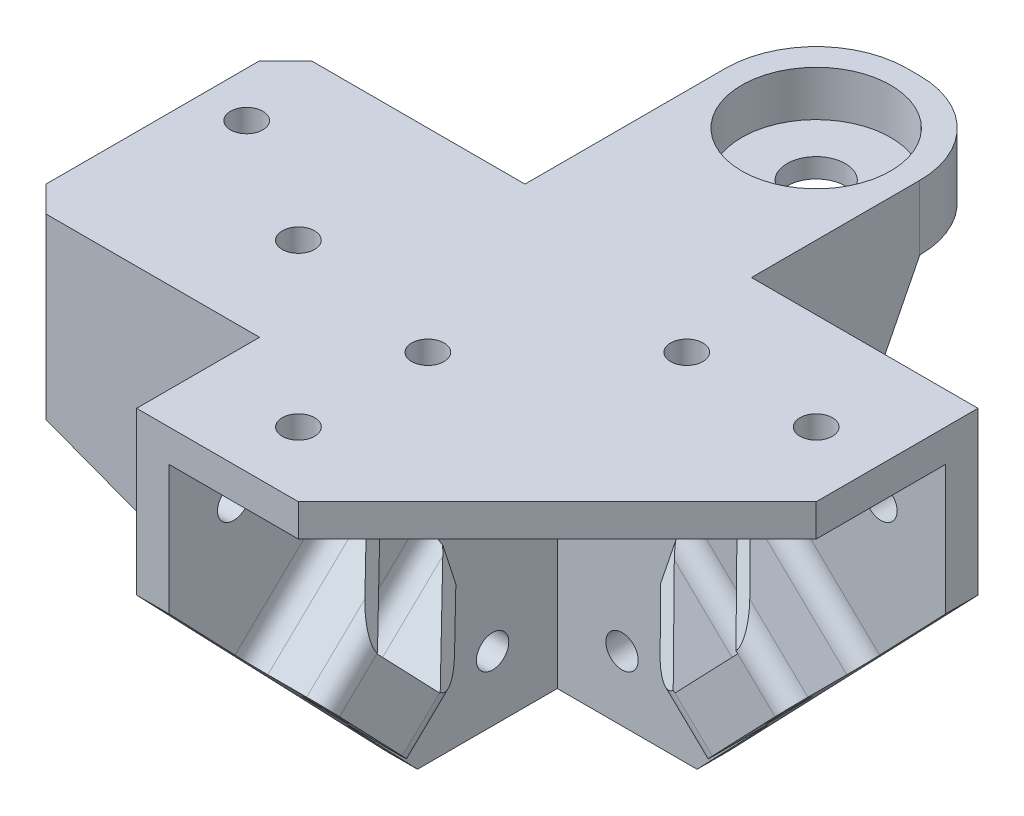
from build123d import *

# Parameters (mm, degrees)
SKETCH1_R           = 2.5
BOSS_EXTRUDE1_DEPTH = 5
BOSS_EXTRUDE3_DEPTH = 5
BOSS_EXTRUDE4_DEPTH = 5
SKETCH5_R           = 2.5
CUT_EXTRUDE1_DEPTH  = 102.612007165
SKETCH6_R           = 2.5
CUT_EXTRUDE2_DEPTH  = 103.610915599
SKETCH7_W           = 30
SKETCH7_H           = 10
BOSS_EXTRUDE5_DEPTH = 40
SKETCH8_R           = 11.5
CUT_EXTRUDE3_DEPTH  = 7
SKETCH9_R           = 4.5
CUT_EXTRUDE4_DEPTH  = 100.76973489
FILLET1_R           = 14
RIB2_REACH          = 106.163
SKETCH10_WALL_W     = 271.162511258
SKETCH10_WALL_H     = 3
RIB11_REACH         = 107.423
SKETCH12_WALL_W     = 270.500688682
SKETCH12_WALL_H     = 3
BOSS_EXTRUDE6_DEPTH = 12
SKETCH15_R          = 3
CUT_EXTRUDE5_DEPTH  = 10
CUT_EXTRUDE6_DEPTH  = 4
BOSS_EXTRUDE7_DEPTH = 12
SKETCH19_R          = 3
CUT_EXTRUDE8_DEPTH  = 36
CUT_EXTRUDE9_DEPTH  = 4
CUT_EXTRUDE10_DEPTH = 23
CUT_EXTRUDE16_DEPTH = 21
FILLET2_R           = 3
SKETCH22_R          = 2.5
CUT_EXTRUDE12_DEPTH = 10
SKETCH30_W          = 35
SKETCH30_H          = 3
BOSS_EXTRUDE8_DEPTH = 37
RIB13_START         = -3
RIB13_DEPTH         = 3
RIB14_START         = -3
RIB14_DEPTH         = 3
CHAMFER1_SIZE       = 4
CUT_EXTRUDE13_REACH = 101.77
SKETCH26_W          = 20
SKETCH26_H          = 20
CUT_EXTRUDE14_REACH = 132.495
SKETCH27_W          = 20
SKETCH27_H          = 20
SKETCH28_W          = 20
SKETCH28_H          = 20
CUT_EXTRUDE15_DEPTH = 60
SKETCH31_R          = 2.5
CUT_EXTRUDE17_DEPTH = 37
CHAMFER2_SIZE       = 3


# Read off the part's stored shape, not the designer's step: Rib13, Rib14
with BuildPart() as part:
    # Sketch1 → Boss-Extrude1 (new body)
    with BuildSketch(Plane(origin=(0, 0, 0), x_dir=(1, 0, 0), z_dir=(0, 1, 0))):
        Polygon((50, -10), (10, -50), (-10, -50), (-10, -31), (-52, -31), (-52, 10), (-10, 10), (-10, 15), (50, 15), align=None)
        with Locations(Location((20, 0, 0), (0, 0, 270))):
            Circle(SKETCH1_R, mode=Mode.SUBTRACT)
        with Locations(Location((40, 0, 0), (0, 0, 270))):
            Circle(SKETCH1_R, mode=Mode.SUBTRACT)
        with Locations(Location((0, -20, 0), (0, 0, 270))):
            Circle(SKETCH1_R, mode=Mode.SUBTRACT)
        with Locations(Location((0, -40, 0), (0, 0, 270))):
            Circle(SKETCH1_R, mode=Mode.SUBTRACT)
    extrude(amount=BOSS_EXTRUDE1_DEPTH)

    # Sketch3 → Boss-Extrude3 (add)
    with BuildSketch(Plane(origin=(0, 0, -15), x_dir=(-1, 0, 0), z_dir=(0, 0, -1))):
        Polygon((-50, 5), (-50, -20), (-11.601154601, -60), (10, -60), (10, 5), align=None)
    extrude(amount=-BOSS_EXTRUDE3_DEPTH)

    # Sketch4 → Boss-Extrude4 (add)
    with BuildSketch(Plane(origin=(-10, 0, 0), x_dir=(0, 0, -1), z_dir=(1, 0, 0))):
        Polygon((15, 5), (-50, 5), (-50, -20), (-11.601154601, -60), (15, -60), align=None)
    extrude(amount=-BOSS_EXTRUDE4_DEPTH)

    # Sketch5 → Cut-Extrude1 (cut, through all)
    with BuildSketch(Plane.ZY.offset(15)):
        with Locations((0, -10)):
            Circle(SKETCH5_R)
        with Locations((0, -30)):
            Circle(SKETCH5_R)
        with Locations((0, -50)):
            Circle(SKETCH5_R)
        with Locations((20, -10)):
            Circle(SKETCH5_R)
        with Locations((40, -10)):
            Circle(SKETCH5_R)
    extrude(amount=-CUT_EXTRUDE1_DEPTH, mode=Mode.SUBTRACT)

    # Sketch6 → Cut-Extrude2 (cut, through all)
    with BuildSketch(Plane(origin=(0, 0, -15), x_dir=(-1, 0, 0), z_dir=(0, 0, -1))):
        with Locations((0, -10)):
            Circle(SKETCH6_R)
        with Locations((0, -30)):
            Circle(SKETCH6_R)
        with Locations((0, -50)):
            Circle(SKETCH6_R)
        with Locations((-20, -10)):
            Circle(SKETCH6_R)
        with Locations((-40, -10)):
            Circle(SKETCH6_R)
    extrude(amount=-CUT_EXTRUDE2_DEPTH, mode=Mode.SUBTRACT)

    # Sketch7 → Boss-Extrude5 (add)
    with BuildSketch(Plane(origin=(0, 0, -15), x_dir=(-1, 0, 0), z_dir=(0, 0, -1))):
        Rectangle(SKETCH7_W, SKETCH7_H)
    extrude(amount=BOSS_EXTRUDE5_DEPTH)

    # Sketch8 → Cut-Extrude3 (cut)
    with BuildSketch(Plane(origin=(0, 5, 0), x_dir=(1, 0, 0), z_dir=(0, 1, 0))):
        with Locations(Location((0, 40, 0), (0, 0, 270))):
            Circle(SKETCH8_R)
    extrude(amount=-CUT_EXTRUDE3_DEPTH, mode=Mode.SUBTRACT)

    # Sketch9 → Cut-Extrude4 (cut, through all)
    with BuildSketch(Plane(origin=(0, 5, 0), x_dir=(1, 0, 0), z_dir=(0, 1, 0))):
        with Locations(Location((0, 40, 0), (0, 0, 270))):
            Circle(SKETCH9_R)
    extrude(amount=-CUT_EXTRUDE4_DEPTH, mode=Mode.SUBTRACT)

    # Fillet1
    fillet1_edges = [part.edges().sort_by_distance(p)[0] for p in [
        (-15, 0, -55),
        (15, 0, -55),
    ]]
    fillet(fillet1_edges, radius=FILLET1_R)

    # Sketch10 wall → Rib2 (add, up to next)
    with BuildSketch(Plane(origin=(-15, -32.5, -28), x_dir=(0, -0.904072266505, 0.427379616893), z_dir=(0, 0.427379616893, 0.904072266505)), mode=Mode.PRIVATE) as rib2_sk1:
        with Locations((0, 1.5)):
            Rectangle(SKETCH10_WALL_W, SKETCH10_WALL_H)
    rib2_tool1 = extrude(rib2_sk1.sketch, amount=RIB2_REACH, mode=Mode.PRIVATE) - part.part
    add(rib2_tool1.solids().sort_by_distance((-15, -32.5, -28))[0])

    # Sketch12 wall → Rib11 (add, up to next)
    with BuildSketch(Plane(origin=(15, -30.729714793, -28), x_dir=(0, -0.892544130701, 0.450960058931), z_dir=(0, -0.450960058931, -0.892544130701)), mode=Mode.PRIVATE) as rib11_sk1:
        with Locations((0, 1.5)):
            Rectangle(SKETCH12_WALL_W, SKETCH12_WALL_H)
    rib11_tool1 = extrude(rib11_sk1.sketch, amount=-RIB11_REACH, mode=Mode.PRIVATE) - part.part
    add(rib11_tool1.solids().sort_by_distance((15, -30.729714793, -28))[0])

    # Sketch13 → Boss-Extrude6 (add)
    with BuildSketch(Plane(origin=(-10, 0, 0), x_dir=(0, 0, -1), z_dir=(1, 0, 0))):
        Polygon((-23.875367383, -47.213977239), (-37.725787218, -32.786022761), (-19.335645208, -15.132017263), (-17.258082232, -17.296210435), (-29.877042452, -29.410047999), (-20.181748567, -39.509616133), (-7.127255585, -26.977679689), (-5.04969261, -29.14187286), align=None)
    extrude(amount=BOSS_EXTRUDE6_DEPTH)

    # Sketch15 → Cut-Extrude5 (cut)
    with BuildSketch(Plane(origin=(0, -34.570859839, 36.012395143), x_dir=(1, 0, 0), z_dir=(0, -0.6925209917473573, 0.7213977238592154))):
        with Locations(Location((-5, -7.525862616, 0), (0, 0, 270))):
            Circle(SKETCH15_R)
    extrude(amount=-CUT_EXTRUDE5_DEPTH, mode=Mode.SUBTRACT)

    # Sketch16 → Cut-Extrude6 (cut)
    with BuildSketch(Plane(origin=(0, -29.030691905, 30.241213352), x_dir=(1, 0, 0), z_dir=(0, 0.692520991747357, -0.7213977238592156))):
        Polygon((0, 4.63911127), (0, 10.412613962), (-5, 13.299365308), (-10, 10.412613962), (-10, 4.63911127), (-5, 1.752359924), align=None)
    extrude(amount=-CUT_EXTRUDE6_DEPTH, mode=Mode.SUBTRACT)

    # Sketch18 → Boss-Extrude7 (add)
    with BuildSketch(Plane.XY.offset(-10)):
        Polygon((37.725787218, -32.786022761), (23.875367383, -47.213977239), (6.052764198, -30.104792631), (8.130327173, -27.940599459), (20.181748567, -39.509616133), (29.877042452, -29.410047999), (17.825621058, -17.841031325), (19.903184033, -15.676838154), align=None)
    extrude(amount=BOSS_EXTRUDE7_DEPTH)

    # Sketch19 → Cut-Extrude8 (cut)
    with BuildSketch(Plane(origin=(36.012395143, -34.570859839, 0), x_dir=(0, 0, -1), z_dir=(0.7213977238592155, -0.6925209917473573, 0))):
        with Locations(Location((5, -7.525862616, 0), (0, 0, 90))):
            Circle(SKETCH19_R)
    extrude(amount=-CUT_EXTRUDE8_DEPTH, mode=Mode.SUBTRACT)

    # Sketch20 → Cut-Extrude9 (cut)
    with BuildSketch(Plane(origin=(30.241213352, -29.030691905, 0), x_dir=(0, 0, 1), z_dir=(-0.7213977238592155, 0.6925209917473573, 0))):
        Polygon((0, -4.63911127), (-5, -1.752359924), (-10, -4.63911127), (-10, -10.412613962), (-5, -13.299365308), (0, -10.412613962), align=None)
    extrude(amount=-CUT_EXTRUDE9_DEPTH, mode=Mode.SUBTRACT)

    # Sketch21 → Cut-Extrude10 (cut)
    with BuildSketch(Plane(origin=(-12.13702776, -12.6431174, 0), x_dir=(0, 0, 1), z_dir=(-0.692520991747357, -0.7213977238592157, 0))):
        Polygon((-10, -25.214651165), (2, -41.537413908), (2, -25.214651165), align=None)
    extrude(amount=-CUT_EXTRUDE10_DEPTH, mode=Mode.SUBTRACT)

    # Sketch29 → Cut-Extrude16 (cut)
    with BuildSketch(Plane(origin=(0, 1.784837077, 1.713392075), x_dir=(1, 0, 0), z_dir=(0, 0.7213977238592151, 0.6925209917473576))):
        Polygon((-10, -24.427930044), (2, -24.427930044), (2, -41.795508388), align=None)
    extrude(amount=-CUT_EXTRUDE16_DEPTH, mode=Mode.SUBTRACT)

    # Fillet2
    # the kernel refuses this fillet: 3 mm, written as the material it adds along each edge
    with BuildSketch(Plane(origin=(35.287525381, -34.603955437, -10), x_dir=(-0.6925209917473568, -0.7213977238592159, 0), z_dir=(-0.7213977238592159, 0.6925209917473568, 0))) as fillet2_piece_1_section:
        with BuildLine():
            CenterArc((FILLET2_R, FILLET2_R), FILLET2_R, 180, 90)
            Line((0, FILLET2_R), (0, 0))
            Line((0, 0), (FILLET2_R, 0))
        make_face()
    fillet2_piece_1 = extrude(amount=31.705654863, mode=Mode.PRIVATE)
    fillet2_piece_1 = split(fillet2_piece_1, bisect_by=Plane(origin=(27.168396229, -27.751311097, 0.000464063), z_dir=(0.4273021697203565, -0.41019774884719234, -0.8056988659499105)), keep=Keep.TOP, mode=Mode.PRIVATE)
    add(fillet2_piece_1)
    with BuildSketch(Plane(origin=(2.719844244, -22.746692021, -10), x_dir=(0.6925209917473568, 0.7213977238592157, 0), z_dir=(0.7213977238592157, -0.6925209917473569, 0))) as fillet2_piece_2_section:
        with BuildLine():
            CenterArc((FILLET2_R, FILLET2_R), FILLET2_R, 180, 90)
            Line((0, FILLET2_R), (0, 0))
            Line((0, 0), (FILLET2_R, 0))
        make_face()
    fillet2_piece_2 = extrude(amount=31.705654863, mode=Mode.PRIVATE)
    fillet2_piece_2 = split(fillet2_piece_2, bisect_by=Plane(origin=(12.953271486, -31.599477719, -5.57934317), z_dir=(0.4273021697203565, -0.41019774884719234, -0.8056988659499105)), keep=Keep.TOP, mode=Mode.PRIVATE)
    add(fillet2_piece_2)
    with BuildSketch(Plane(origin=(-10, -32.786022761, 37.725787218), x_dir=(0, 0.721397723859215, 0.6925209917473576), z_dir=(0, 0.6925209917473576, -0.7213977238592151))) as fillet2_piece_3_section:
        with BuildLine():
            CenterArc((FILLET2_R, FILLET2_R), FILLET2_R, 180, 90)
            Line((0, FILLET2_R), (0, 0))
            Line((0, 0), (FILLET2_R, 0))
        make_face()
    fillet2_piece_3 = extrude(amount=32.992375983, mode=Mode.PRIVATE)
    fillet2_piece_3 = split(fillet2_piece_3, bisect_by=Plane(origin=(-3.605950739, -21.040183536, 26.491984379), z_dir=(-0.822717439175792, -0.3936639310194599, 0.41007892495266446)), keep=Keep.TOP, mode=Mode.PRIVATE)
    add(fillet2_piece_3)
    with BuildSketch(Plane(origin=(-10, -12.102302997, 11.847599303), x_dir=(0, -0.7213977238592152, -0.6925209917473575), z_dir=(0, -0.6925209917473575, 0.7213977238592153))) as fillet2_piece_4_section:
        with BuildLine():
            CenterArc((FILLET2_R, FILLET2_R), FILLET2_R, 180, 90)
            Line((0, FILLET2_R), (0, 0))
            Line((0, 0), (FILLET2_R, 0))
        make_face()
    fillet2_piece_4 = extrude(amount=32.492375983, mode=Mode.PRIVATE)
    fillet2_piece_4 = split(fillet2_piece_4, bisect_by=Plane(origin=(-5.484565801, -22.327549984, 21.487193874), z_dir=(-0.822717439175792, -0.3936639310194599, 0.41007892495266446)), keep=Keep.TOP, mode=Mode.PRIVATE)
    add(fillet2_piece_4)
    with BuildSketch(Plane(origin=(-10, -44.703523571, 25.592231496), x_dir=(0, 0.7213977238592155, 0.6925209917473572), z_dir=(0, 0.6925209917473573, -0.7213977238592155))) as fillet2_piece_5_section:
        with BuildLine():
            CenterArc((FILLET2_R, FILLET2_R), FILLET2_R, 180, 90)
            Line((0, FILLET2_R), (0, 0))
            Line((0, 0), (FILLET2_R, 0))
        make_face()
    fillet2_piece_5 = extrude(amount=24.992375983, mode=Mode.PRIVATE)
    fillet2_piece_5 = split(fillet2_piece_5, bisect_by=Plane(origin=(0.153979839, -37.082991212, 18.634681598), z_dir=(-0.822717439175792, -0.3936639310194599, 0.41007892495266446)), keep=Keep.TOP, mode=Mode.PRIVATE)
    add(fillet2_piece_5)
    with BuildSketch(Plane(origin=(-10, -29.559971741, 5.485225373), x_dir=(0, -0.7213977238592156, -0.692520991747357), z_dir=(0, -0.692520991747357, 0.7213977238592156))) as fillet2_piece_6_section:
        with BuildLine():
            CenterArc((FILLET2_R, FILLET2_R), FILLET2_R, 180, 90)
            Line((0, FILLET2_R), (0, 0))
            Line((0, 0), (FILLET2_R, 0))
        make_face()
    fillet2_piece_6 = extrude(amount=25.492375983, mode=Mode.PRIVATE)
    fillet2_piece_6 = split(fillet2_piece_6, bisect_by=Plane(origin=(-3.60504069, -36.469949644, 11.681680074), z_dir=(-0.822717439175792, -0.3936639310194599, 0.41007892495266446)), keep=Keep.TOP, mode=Mode.PRIVATE)
    add(fillet2_piece_6)
    with BuildSketch(Plane(origin=(14.492701104, -10.482930716, -10), x_dir=(0.692520991747357, 0.7213977238592155, 0), z_dir=(0.7213977238592156, -0.692520991747357, 0))) as fillet2_piece_7_section:
        with BuildLine():
            CenterArc((FILLET2_R, FILLET2_R), FILLET2_R, 180, 90)
            Line((0, FILLET2_R), (0, 0))
            Line((0, 0), (FILLET2_R, 0))
        make_face()
    fillet2_piece_7 = extrude(amount=32.205654863, mode=Mode.PRIVATE)
    fillet2_piece_7 = split(fillet2_piece_7, bisect_by=Plane(origin=(26.602387844, -21.146802925, -3.662208332), z_dir=(0.4273021697203565, -0.41019774884719234, -0.8056988659499105)), keep=Keep.TOP, mode=Mode.PRIVATE)
    add(fillet2_piece_7)
    with BuildSketch(Plane(origin=(23.875367383, -47.213977239, -10), x_dir=(-0.692520991747357, -0.7213977238592156, 0), z_dir=(-0.7213977238592156, 0.6925209917473572, 0))) as fillet2_piece_8_section:
        with BuildLine():
            CenterArc((FILLET2_R, FILLET2_R), FILLET2_R, 180, 90)
            Line((0, FILLET2_R), (0, 0))
            Line((0, 0), (FILLET2_R, 0))
        make_face()
    fillet2_piece_8 = extrude(amount=32.205654863, mode=Mode.PRIVATE)
    fillet2_piece_8 = split(fillet2_piece_8, bisect_by=Plane(origin=(11.791691904, -36.575075089, -3.662208332), z_dir=(0.4273021697203565, -0.41019774884719234, -0.8056988659499105)), keep=Keep.TOP, mode=Mode.PRIVATE)
    add(fillet2_piece_8)
    with BuildSketch(Plane(origin=(-10, -29.14187286, 5.04969261), x_dir=(0, -0.7213977238592156, -0.692520991747357), z_dir=(0, -0.692520991747357, 0.7213977238592156)), Plane(origin=(-10, -27.395778569, 7.562788348), x_dir=(0, 0.7213977238592154, 0.6925209917473572), z_dir=(0, 0.6925209917473573, -0.7213977238592155))) as fillet2_piece_9:
        with BuildLine():
            CenterArc((FILLET2_R, FILLET2_R), FILLET2_R, 180, 90)
            Line((0, FILLET2_R), (0, 0))
            Line((0, 0), (FILLET2_R, 0))
        make_face()
    extrude(amount=0.603734595)
    # the kernel refuses this fillet: 3 mm, written as the material it takes off along each edge
    with BuildSketch(Plane(origin=(2, -37.9799302, 43.136270147), x_dir=(-1, 0, 0), z_dir=(0, 0.6925209917473576, -0.7213977238592151))) as fillet2_2_piece_1:
        with BuildLine():
            CenterArc((FILLET2_R, -FILLET2_R), FILLET2_R, 90, 90)
            Line((0, -FILLET2_R), (0, 0))
            Line((0, 0), (FILLET2_R, 0))
        make_face()
    extrude(amount=23.12479764, mode=Mode.SUBTRACT)
    with BuildSketch(Plane(origin=(2, -36.393476881, 12.603673929), x_dir=(0, 0.7213977238592156, 0.692520991747357), z_dir=(0, -0.692520991747357, 0.7213977238592156))) as fillet2_2_piece_2:
        with BuildLine():
            CenterArc((FILLET2_R, FILLET2_R), FILLET2_R, 180, 90)
            Line((0, FILLET2_R), (0, 0))
            Line((0, 0), (FILLET2_R, 0))
        make_face()
    extrude(amount=23.12479764, mode=Mode.SUBTRACT)
    with BuildSketch(Plane(origin=(26.267904994, -21.786786559, 2), x_dir=(-0.692520991747357, -0.7213977238592156, 0), z_dir=(0.7213977238592156, -0.692520991747357, 0))) as fillet2_2_piece_3:
        with BuildLine():
            CenterArc((FILLET2_R, FILLET2_R), FILLET2_R, 180, 90)
            Line((0, FILLET2_R), (0, 0))
            Line((0, 0), (FILLET2_R, 0))
        make_face()
    extrude(amount=23.38289212, mode=Mode.SUBTRACT)
    with BuildSketch(Plane(origin=(29.285850312, -52.407884677, 2), x_dir=(0, 0, -1), z_dir=(-0.7213977238592156, 0.6925209917473572, 0))) as fillet2_2_piece_4:
        with BuildLine():
            CenterArc((FILLET2_R, -FILLET2_R), FILLET2_R, 90, 90)
            Line((0, -FILLET2_R), (0, 0))
            Line((0, 0), (FILLET2_R, 0))
        make_face()
    extrude(amount=23.38289212, mode=Mode.SUBTRACT)

    # Sketch22 → Cut-Extrude12 (cut)
    with BuildSketch(Plane(origin=(0, 5, 0), x_dir=(1, 0, 0), z_dir=(0, 1, 0))):
        with Locations(Location((-25, -15, 0), (0, 0, 270))):
            Circle(SKETCH22_R)
        with Locations(Location((-45, -3, 0), (0, 0, 270))):
            Circle(SKETCH22_R)
    extrude(amount=-CUT_EXTRUDE12_DEPTH, mode=Mode.SUBTRACT)

    # Sketch30 → Boss-Extrude8 (add)
    with BuildSketch(Plane.ZY.offset(15)):
        with Locations((10.5, -19.5)):
            Rectangle(SKETCH30_W, SKETCH30_H)
    extrude(amount=BOSS_EXTRUDE8_DEPTH)

    # Rib13 outline → Rib13 (add)
    with BuildSketch(Plane.XY.offset(31).offset(RIB13_START)):
        Polygon((-52, 0), (-52, -21), (-15, -35), (-15, 0), align=None)
    extrude(amount=RIB13_DEPTH)

    # Rib14 outline → Rib14 (add)
    with BuildSketch(Plane(origin=(0, 0, -10), x_dir=(-1, 0, 0), z_dir=(0, 0, -1)).offset(RIB14_START)):
        Polygon((52, -21), (52, 0), (15, 0), (15, -35), align=None)
    extrude(amount=RIB14_DEPTH)

    # Chamfer1
    # the kernel refuses this chamfer: 4 mm, written as the material it takes off along each edge
    with BuildSketch(Plane(origin=(-52, -31.286731952, -10), x_dir=(-0.02749587661058563, 0, 0.9996219169112968), z_dir=(0, 1, 0))) as chamfer1_piece_1:
        Polygon((CHAMFER1_SIZE * 0.999621916911, CHAMFER1_SIZE * 0.0274958766106), (-CHAMFER1_SIZE * 0.0274958766106, CHAMFER1_SIZE * 0.999621916911), (0, 0), align=None)
    extrude(amount=46.573463904, mode=Mode.SUBTRACT)
    with BuildSketch(Plane(origin=(-52, 15.286731952, 31), x_dir=(0.9996219169112968, 0, 0.02749587661058651), z_dir=(0, -1, 0))) as chamfer1_piece_2:
        Polygon((CHAMFER1_SIZE * 0.999621916911, -CHAMFER1_SIZE * 0.0274958766106), (-CHAMFER1_SIZE * 0.0274958766106, -CHAMFER1_SIZE * 0.999621916911), (0, 0), align=None)
    extrude(amount=46.573463904, mode=Mode.SUBTRACT)

    # Cut-Extrude13: up to this face of the body (flat: up to its plane)
    cut_extrude13_end = Plane(part.part.faces().sort_by_distance((15.244966533, 0, 15.244966533))[0])
    # Sketch26 → Cut-Extrude13 (cut, up to the picked face)
    with BuildSketch(Plane.XZ.offset(60), mode=Mode.PRIVATE) as cut_extrude13_sk1:
        Rectangle(SKETCH26_W, SKETCH26_H)
    cut_extrude13_tool1 = split(extrude(cut_extrude13_sk1.sketch, amount=-CUT_EXTRUDE13_REACH, mode=Mode.PRIVATE), bisect_by=cut_extrude13_end, keep=Keep.BOTH, mode=Mode.PRIVATE)
    add(cut_extrude13_tool1.solids().sort_by(Axis((0, -60, 0), (0, 1, 0)))[0], mode=Mode.SUBTRACT)

    # Cut-Extrude14: up to this face of the body (flat: up to its plane)
    cut_extrude14_end = Plane(part.part.faces().sort_by_distance((-10, -24.374225062, 13.832072415))[0])
    # Sketch27 → Cut-Extrude14 (cut, up to the picked face)
    with BuildSketch(Plane(origin=(50, 0, 0), x_dir=(0, 0, -1), z_dir=(1, 0, 0)), mode=Mode.PRIVATE) as cut_extrude14_sk1:
        with Locations((0, -10)):
            Rectangle(SKETCH27_W, SKETCH27_H)
    cut_extrude14_tool1 = split(extrude(cut_extrude14_sk1.sketch, amount=-CUT_EXTRUDE14_REACH, mode=Mode.PRIVATE), bisect_by=cut_extrude14_end, keep=Keep.BOTH, mode=Mode.PRIVATE)
    add(cut_extrude14_tool1.solids().sort_by(Axis((50, -10, 0), (-1, 0, 0)))[0], mode=Mode.SUBTRACT)

    # Sketch28 → Cut-Extrude15 (cut)
    with BuildSketch(Plane.XY.offset(50)):
        with Locations((0, -10)):
            Rectangle(SKETCH28_W, SKETCH28_H)
    extrude(amount=-CUT_EXTRUDE15_DEPTH, mode=Mode.SUBTRACT)

    # Sketch31 → Cut-Extrude17 (cut)
    with BuildSketch(Plane(origin=(0, -18, 0), x_dir=(1, 0, 0), z_dir=(0, 1, 0))):
        with Locations(Location((-45, -3, 0), (0, 0, 270))):
            Circle(SKETCH31_R)
        with Locations(Location((-25, -15, 0), (0, 0, 270))):
            Circle(SKETCH31_R)
    extrude(amount=-CUT_EXTRUDE17_DEPTH, mode=Mode.SUBTRACT)

    # Chamfer2
    chamfer2_edges = [part.edges().sort_by_distance(p)[0] for p in [
        (-33, -18, -7),
        (-15, -18, 10.5),
        (-33, -18, 28),
    ]]
    chamfer(chamfer2_edges, length=CHAMFER2_SIZE)


solid = part.part
